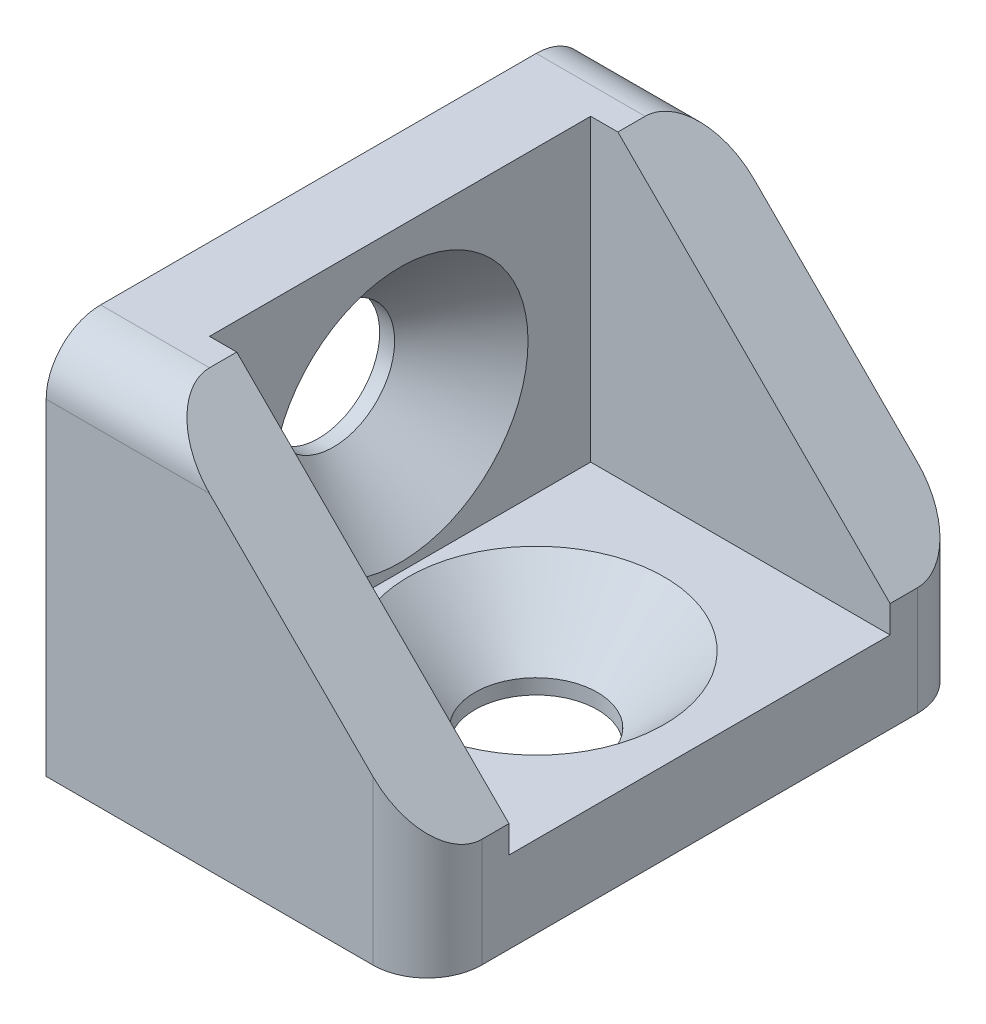
from build123d import *

# Parameters (mm, degrees)
BOSS_EXTRUDE2_DEPTH = 20
SHELL1_START        = 3
SHELL1_OUTLINE_W    = 11
SHELL1_OUTLINE_H    = 14
SHELL1_DEPTH        = 11
FILLET3_R           = 2


# Read off the part's stored shape, not the designer's step: Shell1
with BuildPart() as part:
    # Sketch1 → Boss-Extrude2 (new body)
    with BuildSketch(Plane.XY):
        Polygon((0, 0), (0, 14), (4, 14), (14, 4), (14, 0), align=None)
    extrude(amount=-BOSS_EXTRUDE2_DEPTH)

    # Shell1 outline → Shell1 (cut)
    with BuildSketch(Plane(origin=(0, 0, 0), x_dir=(1, 0, 0), z_dir=(0, 1, 0)).offset(SHELL1_START)):
        with Locations((8.5, 10)):
            Rectangle(SHELL1_OUTLINE_W, SHELL1_OUTLINE_H)
    extrude(amount=SHELL1_DEPTH, mode=Mode.SUBTRACT)

    # Fillet3
    fillet3_edges = [part.edges().sort_by_distance(p)[0] for p in [
        (2, 14, -20),
        (2, 14, 0),
        (14, 2, 0),
        (14, 2, -20),
    ]]
    fillet(fillet3_edges, radius=FILLET3_R)

    # Sketch6 → CSK for M4 Flat Head Machine Screw3 (revolve, cut)
    with BuildSketch(Plane(origin=(3, 8, -10), x_dir=(0, 0, -1), z_dir=(0, 1, 0))):
        Polygon((0, 0), (0, 3), (2.25, 3), (2.25, 2.45), (4.7, 0), align=None)
    revolve(axis=Axis((9.35, 8, -10), (-1, 0, 0)), mode=Mode.SUBTRACT)

    # Sketch9 → CSK for M4 Flat Head Machine Screw2 (revolve, cut)
    with BuildSketch(Plane(origin=(8, 3, -10), x_dir=(0, 0, 1), z_dir=(1, 0, 0))):
        Polygon((0, 0), (0, 3), (2.25, 3), (2.25, 2.45), (4.7, 0), align=None)
    revolve(axis=Axis((8, 9.35, -10), (0, -1, 0)), mode=Mode.SUBTRACT)


solid = part.part
